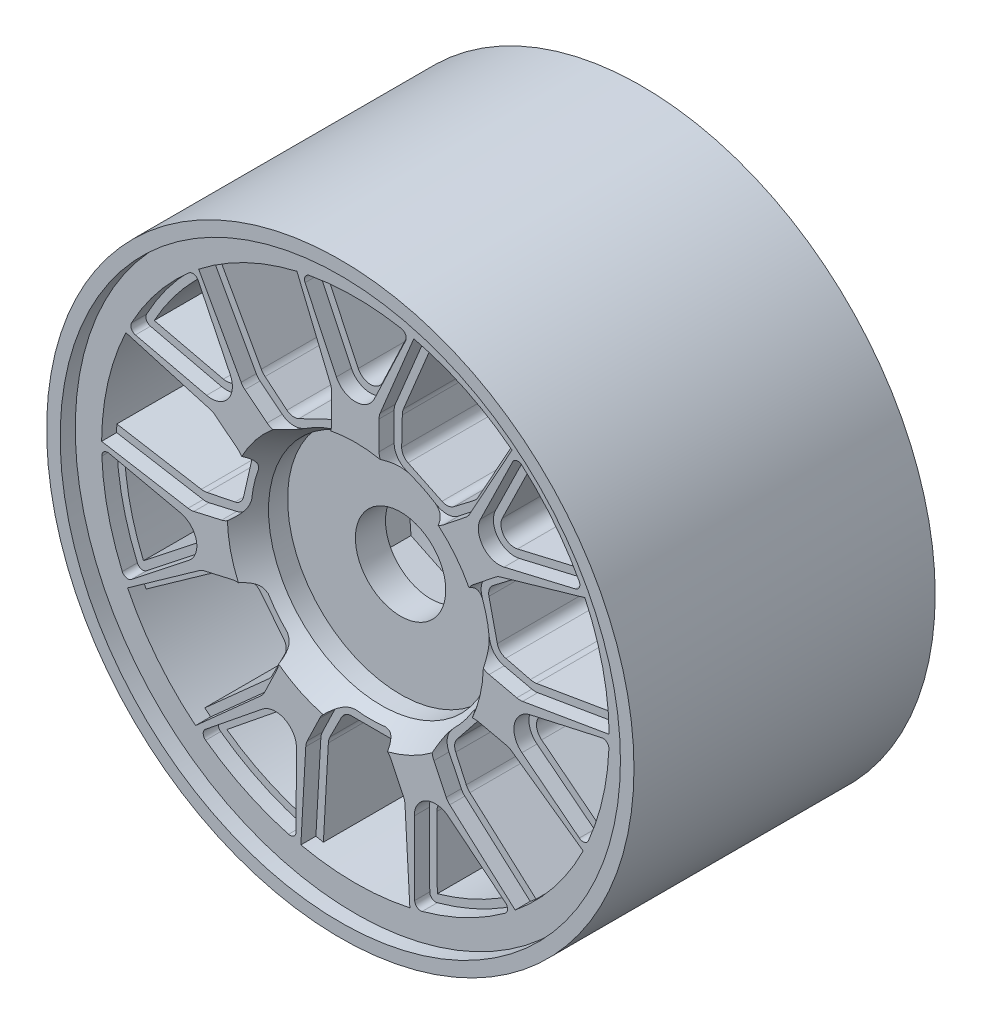
from build123d import *
from build123d.topology import SkipClean

# Parameters (mm, degrees)
SKETCH1_R           = 39
BOSS_EXTRUDE1_DEPTH = 40
SKETCH2_R           = 38
CUT_EXTRUDE1_DEPTH  = 19
SKETCH3_R           = 37.2
CUT_EXTRUDE2_DEPTH  = 2
SKETCH5_R           = 6
CUT_EXTRUDE3_DEPTH  = 67.977608199
CUT_EXTRUDE5_DEPTH  = 2
SKETCH8_R           = 15
CUT_EXTRUDE6_DEPTH  = 6
CUT_EXTRUDE7_DEPTH  = 67.977608199
CUT_EXTRUDE10_DEPTH = 5.5
CUT_EXTRUDE11_START = -5.5
CUT_EXTRUDE11_DEPTH = 5.5
CUT_EXTRUDE12_DEPTH = 3.5
CUT_EXTRUDE14_START = -3.5
SKETCH23_R          = 12.5
CUT_EXTRUDE14_DEPTH = 3.5
CHAMFER1_SIZE       = 2
CHAMFER1_SIZE_2     = 3.464101615
CHAMFER2_SIZE       = 2
CHAMFER2_SIZE2      = 3.464101615


with BuildPart() as part:
    # Sketch1 → Boss-Extrude1 (new body)
    with BuildSketch(Plane.XY):
        Circle(SKETCH1_R)
    extrude(amount=BOSS_EXTRUDE1_DEPTH)

    # Sketch2 → Cut-Extrude1 (cut)
    with BuildSketch(Plane(origin=(0, 0, 0), x_dir=(-1, 0, 0), z_dir=(0, 0, -1))):
        Circle(SKETCH2_R)
    extrude(amount=-CUT_EXTRUDE1_DEPTH, mode=Mode.SUBTRACT)

    # Sketch3 → Cut-Extrude2 (cut)
    with BuildSketch(Plane.XY.offset(40)):
        Circle(SKETCH3_R)
    extrude(amount=-CUT_EXTRUDE2_DEPTH, mode=Mode.SUBTRACT)

    # Sketch5 → Cut-Extrude3 (cut, through all)
    with BuildSketch(Plane.XY.offset(38)):
        Circle(SKETCH5_R)
    extrude(amount=-CUT_EXTRUDE3_DEPTH, mode=Mode.SUBTRACT)

    # Sketch7 → Cut-Extrude5 (cut)
    # profile 1 of 28: a face of its own
    with SkipClean():  # the faces are left unmerged after this step: merging them gives an invalid solid
        with BuildSketch(Plane.XY.offset(38)):
            with BuildLine():
                Line((-6.678926936, 32.03059459), (-2.521652312, 23.260783037))
                ThreePointArc((-2.521652312, 23.260783037), (0, 21.665520789), (2.521652312, 23.260783037))
                Line((2.521652312, 23.260783037), (6.678926936, 32.03059459))
                ThreePointArc((6.678926936, 32.03059459), (6.668415533, 32.725975183), (6.110638146, 33.141365413))
                ThreePointArc((6.110638146, 33.141365413), (0, 33.7), (-6.110638146, 33.141365413))
                ThreePointArc((-6.110638146, 33.141365413), (-6.668415533, 32.725975183), (-6.678926936, 32.03059459))
            make_face()
            with BuildLine():
                ThreePointArc((-1.618040213, 23.689134733), (0, 22.665520789), (1.618040213, 23.689134733))
                Line((1.618040213, 23.689134733), (5.655950279, 32.20714558))
                ThreePointArc((5.655950279, 32.20714558), (0, 32.7), (-5.655950279, 32.20714558))
                Line((-5.655950279, 32.20714558), (-1.618040213, 23.689134733))
            make_face(mode=Mode.SUBTRACT)
        # profile 2 of 28: a face of its own
        with BuildSketch(Plane.XY.offset(38)):
            with BuildLine():
                Line((-5.655950279, 32.20714558), (-1.618040213, 23.689134733))
                ThreePointArc((-1.618040213, 23.689134733), (0, 22.665520789), (1.618040213, 23.689134733))
                Line((1.618040213, 23.689134733), (5.655950279, 32.20714558))
                ThreePointArc((5.655950279, 32.20714558), (0, 32.7), (-5.655950279, 32.20714558))
            make_face()
        # profile 3 of 28: a face of its own
        with BuildSketch(Plane.XY.offset(38)):
            with BuildLine():
                ThreePointArc((-4.565290652, 15.241835898), (-3.533189502, 16.164177877), (-3.15, 17.494258068))
                Line((-3.15, 17.494258068), (-3.15, 21.267696054))
                ThreePointArc((-3.15, 21.267696054), (-3.188429439, 21.657876698), (-3.302240935, 22.033062919))
                Line((-3.302240935, 22.033062919), (-7.759755002, 32.794453835))
                ThreePointArc((-7.759755002, 32.794453835), (-8.250633181, 32.674409744), (-8.739656117, 32.547018465))
                Line((-8.739656117, 32.547018465), (-4.2323922, 21.665520789))
                ThreePointArc((-4.2323922, 21.665520789), (-4.114660372, 21.270080334), (-4.080576857, 20.858896372))
                Line((-4.080576857, 20.858896372), (-4.15, 17.494258068))
                ThreePointArc((-4.15, 17.494258068), (-4.379913701, 16.696209953), (-4.999174391, 16.142804766))
                Line((-4.999174391, 16.142804766), (-9.504018731, 13.973386071))
                ThreePointArc((-9.504018731, 13.973386071), (-10.322791054, 13.834271058), (-11.090079042, 14.152092149))
                Line((-11.090079042, 14.152092149), (-13.98890096, 16.569209067))
                ThreePointArc((-13.98890096, 16.569209067), (-14.269996108, 16.842528065), (-14.4923682, 17.165434258))
                Line((-14.4923682, 17.165434258), (-19.997197236, 27.125672392))
                ThreePointArc((-19.997197236, 27.125672392), (-20.401696562, 26.822766028), (-20.801608349, 26.51382828))
                Line((-20.801608349, 26.51382828), (-15.167228699, 16.319185959))
                ThreePointArc((-15.167228699, 16.319185959), (-14.944856607, 15.996279766), (-14.663761459, 15.722960768))
                Line((-14.663761459, 15.722960768), (-11.713568844, 13.370260666))
                ThreePointArc((-11.713568844, 13.370260666), (-10.43475553, 12.840558848), (-9.070134992, 13.072417203))
                Line((-9.070134992, 13.072417203), (-4.565290652, 15.241835898))
            make_face()
        # profile 4 of 28: a face of its own
        with BuildSketch(Plane.XY.offset(38)):
            with BuildLine():
                ThreePointArc((-19.997197236, 27.125672392), (-14.621882008, 30.362650848), (-8.739656117, 32.547018465))
                Line((-8.739656117, 32.547018465), (-4.2323922, 21.665520789))
                ThreePointArc((-4.2323922, 21.665520789), (-4.114660372, 21.270080334), (-4.080576857, 20.858896372))
                Line((-4.080576857, 20.858896372), (-4.15, 17.494258068))
                ThreePointArc((-4.15, 17.494258068), (-4.379913701, 16.696209953), (-4.999174391, 16.142804766))
                Line((-4.999174391, 16.142804766), (-9.504018731, 13.973386071))
                ThreePointArc((-9.504018731, 13.973386071), (-10.322791054, 13.834271058), (-11.090079042, 14.152092149))
                Line((-11.090079042, 14.152092149), (-13.98890096, 16.569209067))
                ThreePointArc((-13.98890096, 16.569209067), (-14.269996108, 16.842528065), (-14.4923682, 17.165434258))
                Line((-14.4923682, 17.165434258), (-19.997197236, 27.125672392))
            make_face()
        # profile 5 of 28: a face of its own
        with BuildSketch(Plane.XY.offset(38)):
            with BuildLine():
                Line((-29.206770085, 14.748953727), (-19.758236986, 12.531353842))
                ThreePointArc((-19.758236986, 12.531353842), (-16.938786237, 13.508231264), (-16.613787985, 16.474368172))
                Line((-16.613787985, 16.474368172), (-20.878284421, 25.192544422))
                ThreePointArc((-20.878284421, 25.192544422), (-21.428508613, 25.617888985), (-22.101042285, 25.440792635))
                ThreePointArc((-22.101042285, 25.440792635), (-26.347720959, 21.011606323), (-29.720883419, 15.885814074))
                ThreePointArc((-29.720883419, 15.885814074), (-29.743886772, 15.19073458), (-29.206770085, 14.748953727))
            make_face()
            with BuildLine():
                ThreePointArc((-19.529742898, 13.504899142), (-17.720617719, 14.131721065), (-17.512079755, 16.034968699))
                Line((-17.512079755, 16.034968699), (-21.654133056, 24.502826808))
                ThreePointArc((-21.654133056, 24.502826808), (-25.565889477, 20.388116521), (-28.706987694, 15.658826825))
                Line((-28.706987694, 15.658826825), (-19.529742898, 13.504899142))
            make_face(mode=Mode.SUBTRACT)
        # profile 6 of 28: a face of its own
        with BuildSketch(Plane.XY.offset(38)):
            with BuildLine():
                Line((-28.706987694, 15.658826825), (-19.529742898, 13.504899142))
                ThreePointArc((-19.529742898, 13.504899142), (-17.720617719, 14.131721065), (-17.512079755, 16.034968699))
                Line((-17.512079755, 16.034968699), (-21.654133056, 24.502826808))
                ThreePointArc((-21.654133056, 24.502826808), (-25.565889477, 20.388116521), (-28.706987694, 15.658826825))
            make_face()
        # profile 7 of 28: a face of its own
        with BuildSketch(Plane.XY.offset(38)):
            with BuildLine():
                ThreePointArc((-14.76295932, 5.933841286), (-14.840570775, 7.315841275), (-15.641554596, 8.444722327))
                Line((-15.641554596, 8.444722327), (-18.59174721, 10.797422429))
                ThreePointArc((-18.59174721, 10.797422429), (-18.920763085, 11.010650736), (-19.285055791, 11.155594108))
                Line((-19.285055791, 11.155594108), (-30.477864567, 14.380186766))
                ThreePointArc((-30.477864567, 14.380186766), (-30.690067856, 13.921556486), (-30.895370157, 13.459795796))
                Line((-30.895370157, 13.459795796), (-19.577639611, 10.199213795))
                ThreePointArc((-19.577639611, 10.199213795), (-19.19506722, 10.044707154), (-18.852339929, 9.814985712))
                Line((-18.852339929, 9.814985712), (-16.265044398, 7.662890844))
                ThreePointArc((-16.265044398, 7.662890844), (-15.784454105, 6.985562213), (-15.737887232, 6.15636222))
                Line((-15.737887232, 6.15636222), (-16.850491902, 1.281722659))
                ThreePointArc((-16.850491902, 1.281722659), (-17.252223599, 0.554843888), (-17.979102369, 0.153112191))
                Line((-17.979102369, 0.153112191), (-21.676266376, -0.606230298))
                ThreePointArc((-21.676266376, -0.606230298), (-22.065215731, -0.655587726), (-22.45632069, -0.62811651))
                Line((-22.45632069, -0.62811651), (-33.675753201, 1.278141745))
                ThreePointArc((-33.675753201, 1.278141745), (-33.691132675, 0.773032409), (-33.698936338, 0.267749248))
                Line((-33.698936338, 0.267749248), (-22.215465767, -1.683370878))
                ThreePointArc((-22.215465767, -1.683370878), (-21.824360808, -1.710842094), (-21.435411453, -1.661484666))
                Line((-21.435411453, -1.661484666), (-17.756581435, -0.821815721))
                ThreePointArc((-17.756581435, -0.821815721), (-16.545116817, -0.152262893), (-15.87556399, 1.059201725))
                Line((-15.87556399, 1.059201725), (-14.76295932, 5.933841286))
            make_face()
        # profile 8 of 28: a face of its own
        with BuildSketch(Plane.XY.offset(38)):
            with BuildLine():
                ThreePointArc((-33.675753201, 1.278141745), (-32.855070641, 7.498955474), (-30.895370157, 13.459795796))
                Line((-30.895370157, 13.459795796), (-19.577639611, 10.199213795))
                ThreePointArc((-19.577639611, 10.199213795), (-19.19506722, 10.044707154), (-18.852339929, 9.814985712))
                Line((-18.852339929, 9.814985712), (-16.265044398, 7.662890844))
                ThreePointArc((-16.265044398, 7.662890844), (-15.784454105, 6.985562213), (-15.737887232, 6.15636222))
                Line((-15.737887232, 6.15636222), (-16.850491902, 1.281722659))
                ThreePointArc((-16.850491902, 1.281722659), (-17.252223599, 0.554843888), (-17.979102369, 0.153112191))
                Line((-17.979102369, 0.153112191), (-21.676266376, -0.606230298))
                ThreePointArc((-21.676266376, -0.606230298), (-22.065215731, -0.655587726), (-22.45632069, -0.62811651))
                Line((-22.45632069, -0.62811651), (-33.675753201, 1.278141745))
            make_face()
        # profile 9 of 28: a face of its own
        with BuildSketch(Plane.XY.offset(38)):
            with BuildLine():
                ThreePointArc((-32.71372177, -0.61600553), (-33.389328712, -0.780990129), (-33.670187096, -1.417215895))
                ThreePointArc((-33.670187096, -1.417215895), (-32.855070641, -7.498955474), (-30.950697282, -13.332079274))
                ThreePointArc((-30.950697282, -13.332079274), (-30.421604607, -13.783438996), (-29.74131965, -13.638950117))
                Line((-29.74131965, -13.638950117), (-22.116466215, -7.63444039))
                ThreePointArc((-22.116466215, -7.63444039), (-21.211792928, -6.37176583), (-21.122320942, -4.821031951))
                ThreePointArc((-21.122320942, -4.821031951), (-21.875770622, -3.462689405), (-23.23870707, -2.717581942))
                Line((-23.23870707, -2.717581942), (-32.71372177, -0.61600553))
            make_face()
            with BuildLine():
                Line((-22.735150847, -6.848800952), (-30.14107786, -12.680907912))
                ThreePointArc((-30.14107786, -12.680907912), (-31.880142728, -7.27643454), (-32.658212537, -1.652620318))
                Line((-32.658212537, -1.652620318), (-23.455246486, -3.693855819))
                ThreePointArc((-23.455246486, -3.693855819), (-22.097248861, -5.043552854), (-22.735150847, -6.848800952))
            make_face(mode=Mode.SUBTRACT)
        # profile 10 of 28: a face of its own
        with BuildSketch(Plane.XY.offset(38)):
            with BuildLine():
                Line((-30.14107786, -12.680907912), (-22.735150847, -6.848800952))
                ThreePointArc((-22.735150847, -6.848800952), (-22.097248861, -5.043552854), (-23.455246486, -3.693855819))
                Line((-23.455246486, -3.693855819), (-32.658212537, -1.652620318))
                ThreePointArc((-32.658212537, -1.652620318), (-31.880142728, -7.27643454), (-30.14107786, -12.680907912))
            make_face()
        # profile 11 of 28: a face of its own
        with BuildSketch(Plane.XY.offset(38)):
            with BuildLine():
                ThreePointArc((-13.84381851, -7.842456843), (-14.972699562, -7.041473022), (-16.354699551, -6.963861568))
                Line((-16.354699551, -6.963861568), (-20.033529569, -7.803530512))
                ThreePointArc((-20.033529569, -7.803530512), (-20.405376215, -7.927819807), (-20.745830293, -8.122264599))
                Line((-20.745830293, -8.122264599), (-30.245520478, -14.862654239))
                ThreePointArc((-30.245520478, -14.862654239), (-30.019255472, -15.314512754), (-29.786240318, -15.762927637))
                Line((-29.786240318, -15.762927637), (-20.180525083, -8.947309212))
                ThreePointArc((-20.180525083, -8.947309212), (-19.821196943, -8.744535387), (-19.427906517, -8.619809378))
                Line((-19.427906517, -8.619809378), (-16.132178618, -7.93878948))
                ThreePointArc((-16.132178618, -7.93878948), (-15.302978624, -7.985356353), (-14.625649993, -8.465946645))
                Line((-14.625649993, -8.465946645), (-11.508200984, -12.375104058))
                ThreePointArc((-11.508200984, -12.375104058), (-11.190379892, -13.142392046), (-11.329494905, -13.961164369))
                Line((-11.329494905, -13.961164369), (-13.040961095, -17.325165883))
                ThreePointArc((-13.040961095, -17.325165883), (-13.244877861, -17.660032588), (-13.510205675, -17.948682735))
                Line((-13.510205675, -17.948682735), (-21.995780146, -25.531855705))
                ThreePointArc((-21.995780146, -25.531855705), (-21.61045871, -25.858810382), (-21.220277932, -26.17995043))
                Line((-21.220277932, -26.17995043), (-12.535004, -18.41831511))
                ThreePointArc((-12.535004, -18.41831511), (-12.269676185, -18.129664963), (-12.06575942, -17.794798258))
                Line((-12.06575942, -17.794798258), (-10.428526038, -14.395048108))
                ThreePointArc((-10.428526038, -14.395048108), (-10.196667683, -13.03042757), (-10.726369501, -11.751614256))
                Line((-10.726369501, -11.751614256), (-13.84381851, -7.842456843))
            make_face()
        # profile 12 of 28: a face of its own
        with BuildSketch(Plane.XY.offset(38)):
            with BuildLine():
                Line((-20.180525083, -8.947309212), (-29.786240318, -15.762927637))
                ThreePointArc((-29.786240318, -15.762927637), (-26.347720959, -21.011606323), (-21.995780146, -25.531855705))
                Line((-21.995780146, -25.531855705), (-13.510205675, -17.948682735))
                ThreePointArc((-13.510205675, -17.948682735), (-13.244877861, -17.660032588), (-13.040961095, -17.325165883))
                Line((-13.040961095, -17.325165883), (-11.329494905, -13.961164369))
                ThreePointArc((-11.329494905, -13.961164369), (-11.190379892, -13.142392046), (-11.508200984, -12.375104058))
                Line((-11.508200984, -12.375104058), (-14.625649993, -8.465946645))
                ThreePointArc((-14.625649993, -8.465946645), (-15.302978624, -7.985356353), (-16.132178618, -7.93878948))
                Line((-16.132178618, -7.93878948), (-19.427906517, -8.619809378))
                ThreePointArc((-19.427906517, -8.619809378), (-19.821196943, -8.744535387), (-20.180525083, -8.947309212))
            make_face()
        # profile 13 of 28: a face of its own
        with BuildSketch(Plane.XY.offset(38)):
            with BuildLine():
                ThreePointArc((-19.915059388, -25.960690754), (-20.207303272, -26.591767746), (-19.884994277, -27.20803195))
                ThreePointArc((-19.884994277, -27.20803195), (-14.621882008, -30.362650848), (-8.874004813, -32.510645004))
                ThreePointArc((-8.874004813, -32.510645004), (-8.191233685, -32.378401877), (-7.880048907, -31.756446339))
                Line((-7.880048907, -31.756446339), (-7.82054529, -22.051345293))
                ThreePointArc((-7.82054529, -22.051345293), (-8.243689458, -20.556778504), (-9.400317186, -19.519959729))
                ThreePointArc((-9.400317186, -19.519959729), (-10.932080324, -19.262117709), (-12.364405748, -19.863137426))
                Line((-12.364405748, -19.863137426), (-19.915059388, -25.960690754))
            make_face()
            with BuildLine():
                Line((-8.820526495, -22.045214239), (-8.878321631, -31.471660347))
                ThreePointArc((-8.878321631, -31.471660347), (-14.187998269, -29.46168198), (-19.069991871, -26.563610637))
                Line((-19.069991871, -26.563610637), (-11.736134213, -20.641131564))
                ThreePointArc((-11.736134213, -20.641131564), (-9.834200909, -20.420928605), (-8.820526495, -22.045214239))
            make_face(mode=Mode.SUBTRACT)
        # profile 14 of 28: a face of its own
        with BuildSketch(Plane.XY.offset(38)):
            with BuildLine():
                Line((-8.878321631, -31.471660347), (-8.820526495, -22.045214239))
                ThreePointArc((-8.820526495, -22.045214239), (-9.834200909, -20.420928605), (-11.736134213, -20.641131564))
                Line((-11.736134213, -20.641131564), (-19.069991871, -26.563610637))
                ThreePointArc((-19.069991871, -26.563610637), (-14.187998269, -29.46168198), (-8.878321631, -31.471660347))
            make_face()
        # profile 15 of 28: a face of its own
        with BuildSketch(Plane.XY.offset(38)):
            with BuildLine():
                ThreePointArc((-2.5, -15.713225012), (-3.830080191, -16.096414514), (-4.75242217, -17.128515665))
                Line((-4.75242217, -17.128515665), (-6.389655552, -20.528265815))
                ThreePointArc((-6.389655552, -20.528265815), (-6.524324861, -20.896480337), (-6.584571447, -21.283892398))
                Line((-6.584571447, -21.283892398), (-7.237682572, -32.91361346))
                ThreePointArc((-7.237682572, -32.91361346), (-6.743331437, -33.018441531), (-6.247463991, -33.115845055))
                Line((-6.247463991, -33.115845055), (-5.58706356, -21.356325891))
                ThreePointArc((-5.58706356, -21.356325891), (-5.521561089, -20.948964426), (-5.37386324, -20.563712194))
                Line((-5.37386324, -20.563712194), (-3.851453302, -17.562399404))
                ThreePointArc((-3.851453302, -17.562399404), (-3.298048115, -16.943138714), (-2.5, -16.713225012))
                Line((-2.5, -16.713225012), (2.5, -16.713225012))
                ThreePointArc((2.5, -16.713225012), (3.298048115, -16.943138714), (3.851453302, -17.562399404))
                Line((3.851453302, -17.562399404), (5.414453877, -20.99789819))
                ThreePointArc((5.414453877, -20.99789819), (5.549123185, -21.366112712), (5.609369771, -21.753524774))
                Line((5.609369771, -21.753524774), (6.247463991, -33.115845055))
                ThreePointArc((6.247463991, -33.115845055), (6.743331437, -33.018441531), (7.237682572, -32.91361346))
                Line((7.237682572, -32.91361346), (6.584571447, -21.283892398))
                ThreePointArc((6.584571447, -21.283892398), (6.524324861, -20.896480337), (6.389655552, -20.528265815))
                Line((6.389655552, -20.528265815), (4.75242217, -17.128515665))
                ThreePointArc((4.75242217, -17.128515665), (3.830080191, -16.096414514), (2.5, -15.713225012))
                Line((2.5, -15.713225012), (-2.5, -15.713225012))
            make_face()
        # profile 16 of 28: a face of its own
        with BuildSketch(Plane.XY.offset(38)):
            with BuildLine():
                Line((-5.58706356, -21.356325891), (-6.247463991, -33.115845055))
                ThreePointArc((-6.247463991, -33.115845055), (0, -33.7), (6.247463991, -33.115845055))
                Line((6.247463991, -33.115845055), (5.609369771, -21.753524774))
                ThreePointArc((5.609369771, -21.753524774), (5.549123185, -21.366112712), (5.414453877, -20.99789819))
                Line((5.414453877, -20.99789819), (3.851453302, -17.562399404))
                ThreePointArc((3.851453302, -17.562399404), (3.298048115, -16.943138714), (2.5, -16.713225012))
                Line((2.5, -16.713225012), (-2.5, -16.713225012))
                ThreePointArc((-2.5, -16.713225012), (-3.298048115, -16.943138714), (-3.851453302, -17.562399404))
                Line((-3.851453302, -17.562399404), (-5.37386324, -20.563712194))
                ThreePointArc((-5.37386324, -20.563712194), (-5.521561089, -20.948964426), (-5.58706356, -21.356325891))
            make_face()
        # profile 17 of 28: a face of its own
        with BuildSketch(Plane.XY.offset(38)):
            with BuildLine():
                ThreePointArc((8.874004813, -32.510645004), (14.621882008, -30.362650848), (19.884994277, -27.20803195))
                ThreePointArc((19.884994277, -27.20803195), (20.207303272, -26.591767746), (19.915059388, -25.960690754))
                Line((19.915059388, -25.960690754), (12.364405748, -19.863137426))
                ThreePointArc((12.364405748, -19.863137426), (10.932080264, -19.262117702), (9.400317077, -19.519959782))
                ThreePointArc((9.400317077, -19.519959782), (8.243689426, -20.556778556), (7.82054529, -22.051345293))
                Line((7.82054529, -22.051345293), (7.880048907, -31.756446339))
                ThreePointArc((7.880048907, -31.756446339), (8.191233685, -32.378401877), (8.874004813, -32.510645004))
            make_face()
            with BuildLine():
                Line((11.736134213, -20.641131564), (19.069991871, -26.563610637))
                ThreePointArc((19.069991871, -26.563610637), (14.187998269, -29.46168198), (8.878321631, -31.471660347))
                Line((8.878321631, -31.471660347), (8.820526495, -22.045214239))
                ThreePointArc((8.820526495, -22.045214239), (9.834200909, -20.420928605), (11.736134213, -20.641131564))
            make_face(mode=Mode.SUBTRACT)
        # profile 18 of 28: a face of its own
        with BuildSketch(Plane.XY.offset(38)):
            with BuildLine():
                Line((19.069991871, -26.563610637), (11.736134213, -20.641131564))
                ThreePointArc((11.736134213, -20.641131564), (9.834200909, -20.420928605), (8.820526495, -22.045214239))
                Line((8.820526495, -22.045214239), (8.878321631, -31.471660347))
                ThreePointArc((8.878321631, -31.471660347), (14.187998269, -29.46168198), (19.069991871, -26.563610637))
            make_face()
        # profile 19 of 28: a face of its own
        with BuildSketch(Plane.XY.offset(38)):
            with BuildLine():
                Line((20.033529569, -7.803530512), (16.354699551, -6.963861568))
                ThreePointArc((16.354699551, -6.963861568), (14.972699562, -7.041473022), (13.84381851, -7.842456843))
                Line((13.84381851, -7.842456843), (10.726369501, -11.751614256))
                ThreePointArc((10.726369501, -11.751614256), (10.196667683, -13.03042757), (10.428526038, -14.395048108))
                Line((10.428526038, -14.395048108), (12.06575942, -17.794798258))
                ThreePointArc((12.06575942, -17.794798258), (12.269676185, -18.129664963), (12.535004, -18.41831511))
                Line((12.535004, -18.41831511), (21.220277932, -26.17995043))
                ThreePointArc((21.220277932, -26.17995043), (21.61045871, -25.858810382), (21.995780146, -25.531855705))
                Line((21.995780146, -25.531855705), (13.213570779, -17.683593584))
                ThreePointArc((13.213570779, -17.683593584), (12.935922884, -17.378395971), (12.726808663, -17.022720305))
                Line((12.726808663, -17.022720305), (11.329494905, -13.961164369))
                ThreePointArc((11.329494905, -13.961164369), (11.190379892, -13.142392046), (11.508200984, -12.375104058))
                Line((11.508200984, -12.375104058), (14.625649993, -8.465946645))
                ThreePointArc((14.625649993, -8.465946645), (15.302978624, -7.985356353), (16.132178618, -7.93878948))
                Line((16.132178618, -7.93878948), (19.792674645, -8.85878488))
                ThreePointArc((19.792674645, -8.85878488), (20.164521291, -8.983074175), (20.50497537, -9.177518967))
                Line((20.50497537, -9.177518967), (29.786240318, -15.762927637))
                ThreePointArc((29.786240318, -15.762927637), (30.019255472, -15.314512754), (30.245520478, -14.862654239))
                Line((30.245520478, -14.862654239), (20.745830293, -8.122264599))
                ThreePointArc((20.745830293, -8.122264599), (20.405376215, -7.927819807), (20.033529569, -7.803530512))
            make_face()
        # profile 20 of 28: a face of its own
        with BuildSketch(Plane.XY.offset(38)):
            with BuildLine():
                ThreePointArc((21.995780146, -25.531855705), (26.347720959, -21.011606323), (29.786240318, -15.762927637))
                Line((29.786240318, -15.762927637), (20.50497537, -9.177518967))
                ThreePointArc((20.50497537, -9.177518967), (20.164521291, -8.983074175), (19.792674645, -8.85878488))
                Line((19.792674645, -8.85878488), (16.132178618, -7.93878948))
                ThreePointArc((16.132178618, -7.93878948), (15.302978624, -7.985356353), (14.625649993, -8.465946645))
                Line((14.625649993, -8.465946645), (11.508200984, -12.375104058))
                ThreePointArc((11.508200984, -12.375104058), (11.190379892, -13.142392046), (11.329494905, -13.961164369))
                Line((11.329494905, -13.961164369), (12.726808663, -17.022720305))
                ThreePointArc((12.726808663, -17.022720305), (12.935922884, -17.378395971), (13.213570779, -17.683593584))
                Line((13.213570779, -17.683593584), (21.995780146, -25.531855705))
            make_face()
        # profile 21 of 28: a face of its own
        with BuildSketch(Plane.XY.offset(38)):
            with BuildLine():
                ThreePointArc((30.950697282, -13.332079274), (32.855070641, -7.498955474), (33.670187096, -1.417215895))
                ThreePointArc((33.670187096, -1.417215895), (33.389328712, -0.780990129), (32.71372177, -0.61600553))
                Line((32.71372177, -0.61600553), (23.23870707, -2.717581942))
                ThreePointArc((23.23870707, -2.717581942), (21.875770612, -3.462689415), (21.122320936, -4.821031978))
                ThreePointArc((21.122320936, -4.821031978), (21.211792933, -6.371765843), (22.116466215, -7.63444039))
                Line((22.116466215, -7.63444039), (29.74131965, -13.638950117))
                ThreePointArc((29.74131965, -13.638950117), (30.421604607, -13.783438996), (30.950697282, -13.332079274))
            make_face()
            with BuildLine():
                Line((23.455246486, -3.693855819), (32.658212537, -1.652620318))
                ThreePointArc((32.658212537, -1.652620318), (31.880142728, -7.27643454), (30.14107786, -12.680907912))
                Line((30.14107786, -12.680907912), (22.735150847, -6.848800952))
                ThreePointArc((22.735150847, -6.848800952), (22.097248861, -5.043552854), (23.455246486, -3.693855819))
            make_face(mode=Mode.SUBTRACT)
        # profile 22 of 28: a face of its own
        with BuildSketch(Plane.XY.offset(38)):
            with BuildLine():
                Line((32.658212537, -1.652620318), (23.455246486, -3.693855819))
                ThreePointArc((23.455246486, -3.693855819), (22.097248861, -5.043552854), (22.735150847, -6.848800952))
                Line((22.735150847, -6.848800952), (30.14107786, -12.680907912))
                ThreePointArc((30.14107786, -12.680907912), (31.880142728, -7.27643454), (32.658212537, -1.652620318))
            make_face()
        # profile 23 of 28: a face of its own
        with BuildSketch(Plane.XY.offset(38)):
            with BuildLine():
                Line((18.59174721, 10.797422429), (15.641554596, 8.444722327))
                ThreePointArc((15.641554596, 8.444722327), (14.840570775, 7.315841275), (14.76295932, 5.933841286))
                Line((14.76295932, 5.933841286), (15.87556399, 1.059201725))
                ThreePointArc((15.87556399, 1.059201725), (16.545116817, -0.152262893), (17.756581435, -0.821815721))
                Line((17.756581435, -0.821815721), (21.435411453, -1.661484666))
                ThreePointArc((21.435411453, -1.661484666), (21.824360808, -1.710842094), (22.215465767, -1.683370878))
                Line((22.215465767, -1.683370878), (33.698936338, 0.267749248))
                ThreePointArc((33.698936338, 0.267749248), (33.691132675, 0.773032409), (33.675753201, 1.278141745))
                Line((33.675753201, 1.278141745), (22.064116814, -0.694754629))
                ThreePointArc((22.064116814, -0.694754629), (21.652393081, -0.721540895), (21.243934063, -0.663272826))
                Line((21.243934063, -0.663272826), (17.979102369, 0.153112191))
                ThreePointArc((17.979102369, 0.153112191), (17.252223599, 0.554843888), (16.850491902, 1.281722659))
                Line((16.850491902, 1.281722659), (15.737887232, 6.15636222))
                ThreePointArc((15.737887232, 6.15636222), (15.784454105, 6.985562213), (16.265044398, 7.662890844))
                Line((16.265044398, 7.662890844), (19.266607709, 9.95117413))
                ThreePointArc((19.266607709, 9.95117413), (19.595623584, 10.164402437), (19.95991629, 10.309345809))
                Line((19.95991629, 10.309345809), (30.895370157, 13.459795796))
                ThreePointArc((30.895370157, 13.459795796), (30.690067856, 13.921556486), (30.477864567, 14.380186766))
                Line((30.477864567, 14.380186766), (19.285055791, 11.155594108))
                ThreePointArc((19.285055791, 11.155594108), (18.920763085, 11.010650736), (18.59174721, 10.797422429))
            make_face()
        # profile 24 of 28: a face of its own
        with BuildSketch(Plane.XY.offset(38)):
            with BuildLine():
                ThreePointArc((30.895370157, 13.459795796), (32.855070641, 7.498955474), (33.675753201, 1.278141745))
                Line((33.675753201, 1.278141745), (22.064116814, -0.694754629))
                ThreePointArc((22.064116814, -0.694754629), (21.652393081, -0.721540895), (21.243934063, -0.663272826))
                Line((21.243934063, -0.663272826), (17.979102369, 0.153112191))
                ThreePointArc((17.979102369, 0.153112191), (17.252223599, 0.554843888), (16.850491902, 1.281722659))
                Line((16.850491902, 1.281722659), (15.737887232, 6.15636222))
                ThreePointArc((15.737887232, 6.15636222), (15.784454105, 6.985562213), (16.265044398, 7.662890844))
                Line((16.265044398, 7.662890844), (19.266607709, 9.95117413))
                ThreePointArc((19.266607709, 9.95117413), (19.595623584, 10.164402437), (19.95991629, 10.309345809))
                Line((19.95991629, 10.309345809), (30.895370157, 13.459795796))
            make_face()
        # profile 25 of 28: a face of its own
        with BuildSketch(Plane.XY.offset(38)):
            with BuildLine():
                ThreePointArc((8.739656117, 32.547018465), (14.621882008, 30.362650848), (19.997197236, 27.125672392))
                Line((19.997197236, 27.125672392), (14.299932862, 16.817248732))
                ThreePointArc((14.299932862, 16.817248732), (14.064169659, 16.478649191), (13.763943817, 16.195632619))
                Line((13.763943817, 16.195632619), (11.090079042, 14.152092149))
                ThreePointArc((11.090079042, 14.152092149), (10.322791054, 13.834271058), (9.504018731, 13.973386071))
                Line((9.504018731, 13.973386071), (4.999174391, 16.142804766))
                ThreePointArc((4.999174391, 16.142804766), (4.379913701, 16.696209953), (4.15, 17.494258068))
                Line((4.15, 17.494258068), (4.2323922, 21.267696054))
                ThreePointArc((4.2323922, 21.267696054), (4.270821639, 21.657876698), (4.384633135, 22.033062919))
                Line((4.384633135, 22.033062919), (8.739656117, 32.547018465))
            make_face()
        # profile 26 of 28: a face of its own
        with BuildSketch(Plane.XY.offset(38)):
            with BuildLine():
                Line((3.15, 21.267696054), (3.15, 17.494258068))
                ThreePointArc((3.15, 17.494258068), (3.533189502, 16.164177877), (4.565290652, 15.241835898))
                Line((4.565290652, 15.241835898), (9.070134992, 13.072417203))
                ThreePointArc((9.070134992, 13.072417203), (10.43475553, 12.840558848), (11.713568844, 13.370260666))
                Line((11.713568844, 13.370260666), (14.663761459, 15.722960768))
                ThreePointArc((14.663761459, 15.722960768), (14.944856607, 15.996279766), (15.167228699, 16.319185959))
                Line((15.167228699, 16.319185959), (20.801608349, 26.51382828))
                ThreePointArc((20.801608349, 26.51382828), (20.401696562, 26.822766028), (19.997197236, 27.125672392))
                Line((19.997197236, 27.125672392), (14.299932862, 16.817248732))
                ThreePointArc((14.299932862, 16.817248732), (14.064169659, 16.478649191), (13.763943817, 16.195632619))
                Line((13.763943817, 16.195632619), (11.090079042, 14.152092149))
                ThreePointArc((11.090079042, 14.152092149), (10.322791054, 13.834271058), (9.504018731, 13.973386071))
                Line((9.504018731, 13.973386071), (4.999174391, 16.142804766))
                ThreePointArc((4.999174391, 16.142804766), (4.379913701, 16.696209953), (4.15, 17.494258068))
                Line((4.15, 17.494258068), (4.2323922, 21.267696054))
                ThreePointArc((4.2323922, 21.267696054), (4.270821639, 21.657876698), (4.384633135, 22.033062919))
                Line((4.384633135, 22.033062919), (8.739656117, 32.547018465))
                ThreePointArc((8.739656117, 32.547018465), (8.250633181, 32.674409744), (7.759755002, 32.794453835))
                Line((7.759755002, 32.794453835), (3.302240935, 22.033062919))
                ThreePointArc((3.302240935, 22.033062919), (3.188429439, 21.657876698), (3.15, 21.267696054))
            make_face()
        # profile 27 of 28: a face of its own
        with BuildSketch(Plane.XY.offset(38)):
            with BuildLine():
                Line((20.878284421, 25.192544422), (16.613787985, 16.474368172))
                ThreePointArc((16.613787985, 16.474368172), (16.938786237, 13.508231264), (19.758236986, 12.531353842))
                Line((19.758236986, 12.531353842), (29.206770085, 14.748953727))
                ThreePointArc((29.206770085, 14.748953727), (29.743886772, 15.19073458), (29.720883419, 15.885814074))
                ThreePointArc((29.720883419, 15.885814074), (26.347720959, 21.011606323), (22.101042285, 25.440792635))
                ThreePointArc((22.101042285, 25.440792635), (21.428508613, 25.617888985), (20.878284421, 25.192544422))
            make_face()
            with BuildLine():
                ThreePointArc((17.512079755, 16.034968699), (17.720617719, 14.131721065), (19.529742898, 13.504899142))
                Line((19.529742898, 13.504899142), (28.706987694, 15.658826825))
                ThreePointArc((28.706987694, 15.658826825), (25.565889477, 20.388116521), (21.654133056, 24.502826808))
                Line((21.654133056, 24.502826808), (17.512079755, 16.034968699))
            make_face(mode=Mode.SUBTRACT)
        # profile 28 of 28: a face of its own
        with BuildSketch(Plane.XY.offset(38)):
            with BuildLine():
                Line((21.654133056, 24.502826808), (17.512079755, 16.034968699))
                ThreePointArc((17.512079755, 16.034968699), (17.720617719, 14.131721065), (19.529742898, 13.504899142))
                Line((19.529742898, 13.504899142), (28.706987694, 15.658826825))
                ThreePointArc((28.706987694, 15.658826825), (25.565889477, 20.388116521), (21.654133056, 24.502826808))
            make_face()
        extrude(amount=-CUT_EXTRUDE5_DEPTH, mode=Mode.SUBTRACT)

    # Sketch8 → Cut-Extrude6 (cut)
    with SkipClean():  # the faces are left unmerged after this step: merging them gives an invalid solid
        with BuildSketch(Plane.XY.offset(38)):
            Circle(SKETCH8_R)
        extrude(amount=-CUT_EXTRUDE6_DEPTH, mode=Mode.SUBTRACT)

    # Sketch9 → Cut-Extrude7 (cut, through all)
    with SkipClean():  # the faces are left unmerged after this step: merging them gives an invalid solid
        with BuildSketch(Plane.XY.offset(38)):
            with BuildLine():
                ThreePointArc((-8.739656117, 32.547018465), (-14.621882008, 30.362650848), (-19.997197236, 27.125672392))
                Line((-19.997197236, 27.125672392), (-14.4923682, 17.165434258))
                ThreePointArc((-14.4923682, 17.165434258), (-14.269996108, 16.842528065), (-13.98890096, 16.569209067))
                Line((-13.98890096, 16.569209067), (-11.090079042, 14.152092149))
                ThreePointArc((-11.090079042, 14.152092149), (-10.322791054, 13.834271058), (-9.504018731, 13.973386071))
                Line((-9.504018731, 13.973386071), (-4.999174391, 16.142804766))
                ThreePointArc((-4.999174391, 16.142804766), (-4.379913701, 16.696209953), (-4.15, 17.494258068))
                Line((-4.15, 17.494258068), (-4.080576857, 20.858896372))
                ThreePointArc((-4.080576857, 20.858896372), (-4.114660372, 21.270080334), (-4.2323922, 21.665520789))
                Line((-4.2323922, 21.665520789), (-8.739656117, 32.547018465))
            make_face()
            with BuildLine():
                Line((-17.512079755, 16.034968699), (-21.654133056, 24.502826808))
                ThreePointArc((-21.654133056, 24.502826808), (-25.565889477, 20.388116521), (-28.706987694, 15.658826825))
                Line((-28.706987694, 15.658826825), (-19.529742898, 13.504899142))
                ThreePointArc((-19.529742898, 13.504899142), (-17.720617719, 14.131721065), (-17.512079755, 16.034968699))
            make_face()
            with BuildLine():
                Line((1.618040213, 23.689134733), (5.655950279, 32.20714558))
                ThreePointArc((5.655950279, 32.20714558), (0, 32.7), (-5.655950279, 32.20714558))
                Line((-5.655950279, 32.20714558), (-1.618040213, 23.689134733))
                ThreePointArc((-1.618040213, 23.689134733), (0, 22.665520789), (1.618040213, 23.689134733))
            make_face()
            with BuildLine():
                ThreePointArc((-30.895370157, 13.459795796), (-32.855070641, 7.498955474), (-33.675753201, 1.278141745))
                Line((-33.675753201, 1.278141745), (-22.45632069, -0.62811651))
                ThreePointArc((-22.45632069, -0.62811651), (-22.065215731, -0.655587726), (-21.676266376, -0.606230298))
                Line((-21.676266376, -0.606230298), (-17.979102369, 0.153112191))
                ThreePointArc((-17.979102369, 0.153112191), (-17.252223599, 0.554843888), (-16.850491902, 1.281722659))
                Line((-16.850491902, 1.281722659), (-15.737887232, 6.15636222))
                ThreePointArc((-15.737887232, 6.15636222), (-15.784454105, 6.985562213), (-16.265044398, 7.662890844))
                Line((-16.265044398, 7.662890844), (-18.852339929, 9.814985712))
                ThreePointArc((-18.852339929, 9.814985712), (-19.19506722, 10.044707154), (-19.577639611, 10.199213795))
                Line((-19.577639611, 10.199213795), (-30.895370157, 13.459795796))
            make_face()
            with BuildLine():
                ThreePointArc((19.997197236, 27.125672392), (14.621882008, 30.362650848), (8.739656117, 32.547018465))
                Line((8.739656117, 32.547018465), (4.384633135, 22.033062919))
                ThreePointArc((4.384633135, 22.033062919), (4.270821639, 21.657876698), (4.2323922, 21.267696054))
                Line((4.2323922, 21.267696054), (4.15, 17.494258068))
                ThreePointArc((4.15, 17.494258068), (4.379913701, 16.696209953), (4.999174391, 16.142804766))
                Line((4.999174391, 16.142804766), (9.504018731, 13.973386071))
                ThreePointArc((9.504018731, 13.973386071), (10.322791054, 13.834271058), (11.090079042, 14.152092149))
                Line((11.090079042, 14.152092149), (13.763943817, 16.195632619))
                ThreePointArc((13.763943817, 16.195632619), (14.064169659, 16.478649191), (14.299932862, 16.817248732))
                Line((14.299932862, 16.817248732), (19.997197236, 27.125672392))
            make_face()
            with BuildLine():
                Line((21.654133056, 24.502826808), (17.512079755, 16.034968699))
                ThreePointArc((17.512079755, 16.034968699), (17.720617719, 14.131721065), (19.529742898, 13.504899142))
                Line((19.529742898, 13.504899142), (28.706987694, 15.658826825))
                ThreePointArc((28.706987694, 15.658826825), (25.565889477, 20.388116521), (21.654133056, 24.502826808))
            make_face()
            with BuildLine():
                ThreePointArc((33.675753201, 1.278141745), (32.855070641, 7.498955474), (30.895370157, 13.459795796))
                Line((30.895370157, 13.459795796), (19.95991629, 10.309345809))
                ThreePointArc((19.95991629, 10.309345809), (19.595623584, 10.164402437), (19.266607709, 9.95117413))
                Line((19.266607709, 9.95117413), (16.265044398, 7.662890844))
                ThreePointArc((16.265044398, 7.662890844), (15.784454105, 6.985562213), (15.737887232, 6.15636222))
                Line((15.737887232, 6.15636222), (16.850491902, 1.281722659))
                ThreePointArc((16.850491902, 1.281722659), (17.252223599, 0.554843888), (17.979102369, 0.153112191))
                Line((17.979102369, 0.153112191), (21.243934063, -0.663272826))
                ThreePointArc((21.243934063, -0.663272826), (21.652393081, -0.721540895), (22.064116814, -0.694754629))
                Line((22.064116814, -0.694754629), (33.675753201, 1.278141745))
            make_face()
            with BuildLine():
                Line((22.735150847, -6.848800952), (30.14107786, -12.680907912))
                ThreePointArc((30.14107786, -12.680907912), (31.880142728, -7.27643454), (32.658212537, -1.652620318))
                Line((32.658212537, -1.652620318), (23.455246486, -3.693855819))
                ThreePointArc((23.455246486, -3.693855819), (22.097248861, -5.043552854), (22.735150847, -6.848800952))
            make_face()
            with BuildLine():
                Line((13.213570779, -17.683593584), (21.995780146, -25.531855705))
                ThreePointArc((21.995780146, -25.531855705), (26.347720959, -21.011606323), (29.786240318, -15.762927637))
                Line((29.786240318, -15.762927637), (20.50497537, -9.177518967))
                ThreePointArc((20.50497537, -9.177518967), (20.164521291, -8.983074175), (19.792674645, -8.85878488))
                Line((19.792674645, -8.85878488), (16.132178618, -7.93878948))
                ThreePointArc((16.132178618, -7.93878948), (15.302978624, -7.985356353), (14.625649993, -8.465946645))
                Line((14.625649993, -8.465946645), (11.508200984, -12.375104058))
                ThreePointArc((11.508200984, -12.375104058), (11.190379892, -13.142392046), (11.329494905, -13.961164369))
                Line((11.329494905, -13.961164369), (12.726808663, -17.022720305))
                ThreePointArc((12.726808663, -17.022720305), (12.935922884, -17.378395971), (13.213570779, -17.683593584))
            make_face()
            with BuildLine():
                Line((8.820526495, -22.045214239), (8.878321631, -31.471660347))
                ThreePointArc((8.878321631, -31.471660347), (14.187998269, -29.46168198), (19.069991871, -26.563610637))
                Line((19.069991871, -26.563610637), (11.736134213, -20.641131564))
                ThreePointArc((11.736134213, -20.641131564), (9.834200909, -20.420928605), (8.820526495, -22.045214239))
            make_face()
            with BuildLine():
                Line((-5.58706356, -21.356325891), (-6.247463991, -33.115845055))
                ThreePointArc((-6.247463991, -33.115845055), (0, -33.7), (6.247463991, -33.115845055))
                Line((6.247463991, -33.115845055), (5.609369771, -21.753524774))
                ThreePointArc((5.609369771, -21.753524774), (5.549123185, -21.366112712), (5.414453877, -20.99789819))
                Line((5.414453877, -20.99789819), (3.851453302, -17.562399404))
                ThreePointArc((3.851453302, -17.562399404), (3.298048115, -16.943138714), (2.5, -16.713225012))
                Line((2.5, -16.713225012), (-2.5, -16.713225012))
                ThreePointArc((-2.5, -16.713225012), (-3.298048115, -16.943138714), (-3.851453302, -17.562399404))
                Line((-3.851453302, -17.562399404), (-5.37386324, -20.563712194))
                ThreePointArc((-5.37386324, -20.563712194), (-5.521561089, -20.948964426), (-5.58706356, -21.356325891))
            make_face()
            with BuildLine():
                Line((-8.878321631, -31.471660347), (-8.820526495, -22.045214239))
                ThreePointArc((-8.820526495, -22.045214239), (-9.834200909, -20.420928605), (-11.736134213, -20.641131564))
                Line((-11.736134213, -20.641131564), (-19.069991871, -26.563610637))
                ThreePointArc((-19.069991871, -26.563610637), (-14.187998269, -29.46168198), (-8.878321631, -31.471660347))
            make_face()
            with BuildLine():
                Line((-20.180525083, -8.947309212), (-29.786240318, -15.762927637))
                ThreePointArc((-29.786240318, -15.762927637), (-26.347720959, -21.011606323), (-21.995780146, -25.531855705))
                Line((-21.995780146, -25.531855705), (-13.510205675, -17.948682735))
                ThreePointArc((-13.510205675, -17.948682735), (-13.244877861, -17.660032588), (-13.040961095, -17.325165883))
                Line((-13.040961095, -17.325165883), (-11.329494905, -13.961164369))
                ThreePointArc((-11.329494905, -13.961164369), (-11.190379892, -13.142392046), (-11.508200984, -12.375104058))
                Line((-11.508200984, -12.375104058), (-14.625649993, -8.465946645))
                ThreePointArc((-14.625649993, -8.465946645), (-15.302978624, -7.985356353), (-16.132178618, -7.93878948))
                Line((-16.132178618, -7.93878948), (-19.427906517, -8.619809378))
                ThreePointArc((-19.427906517, -8.619809378), (-19.821196943, -8.744535387), (-20.180525083, -8.947309212))
            make_face()
            with BuildLine():
                Line((-30.14107786, -12.680907912), (-22.735150847, -6.848800952))
                ThreePointArc((-22.735150847, -6.848800952), (-22.097248861, -5.043552854), (-23.455246486, -3.693855819))
                Line((-23.455246486, -3.693855819), (-32.658212537, -1.652620318))
                ThreePointArc((-32.658212537, -1.652620318), (-31.880142728, -7.27643454), (-30.14107786, -12.680907912))
            make_face()
        extrude(amount=-CUT_EXTRUDE7_DEPTH, mode=Mode.SUBTRACT)

    # Sketch19 → Cut-Extrude10 (cut)
    with SkipClean():  # the faces are left unmerged after this step: merging them gives an invalid solid
        with BuildSketch(Plane(origin=(0, 0, 19), x_dir=(-1, 0, 0), z_dir=(0, 0, -1))):
            Polygon((-0.733472474, -9.787509973), (8.109496039, -5.528960782), (8.842968513, 4.258549191), (0.733472474, 9.787509973), (-8.109496039, 5.528960782), (-8.842968513, -4.258549191), align=None)
        extrude(amount=-CUT_EXTRUDE10_DEPTH, mode=Mode.SUBTRACT)

    # Sketch20 → Cut-Extrude11 (cut)
    with BuildSketch(Plane(origin=(0, 0, 19), x_dir=(-1, 0, 0), z_dir=(0, 0, -1)).offset(CUT_EXTRUDE11_START)):
        with BuildLine():
            Line((-19.645228504, -3.554280029), (-33.695814755, -0.531100733))
            ThreePointArc((-33.695814755, -0.531100733), (-32.855070641, -7.498955474), (-30.589316045, -14.141560873))
            Line((-30.589316045, -14.141560873), (-19.241883594, -5.321449546))
            ThreePointArc((-19.241883594, -5.321449546), (-18.880650476, -4.309385263), (-19.645228504, -3.554280029))
        make_face()
        with BuildLine():
            Line((-15.027447651, 13.143200774), (-21.424228138, 26.013312912))
            ThreePointArc((-21.424228138, 26.013312912), (-26.347720959, 21.011606323), (-30.128444101, 15.098571324))
            Line((-30.128444101, 15.098571324), (-16.157594976, 11.726040853))
            ThreePointArc((-16.157594976, 11.726040853), (-15.141106094, 12.074629188), (-15.027447651, 13.143200774))
        make_face()
        with BuildLine():
            Line((0.906307787, 19.943583321), (6.980239241, 32.96917136))
            ThreePointArc((6.980239241, 32.96917136), (0, 33.7), (-6.980239241, 32.96917136))
            Line((-6.980239241, 32.96917136), (-0.906307787, 19.943583321))
            ThreePointArc((-0.906307787, 19.943583321), (0, 19.366201583), (0.906307787, 19.943583321))
        make_face()
        with BuildLine():
            ThreePointArc((30.128444101, 15.098571324), (26.347720959, 21.011606323), (21.424228138, 26.013312912))
            Line((21.424228138, 26.013312912), (15.027447651, 13.143200774))
            ThreePointArc((15.027447651, 13.143200774), (15.141106094, 12.074629188), (16.157594976, 11.726040853))
            Line((16.157594976, 11.726040853), (30.128444101, 15.098571324))
        make_face()
        with BuildLine():
            ThreePointArc((30.589316045, -14.141560873), (32.855070641, -7.498955474), (33.695814755, -0.531100733))
            Line((33.695814755, -0.531100733), (19.645228504, -3.554280029))
            ThreePointArc((19.645228504, -3.554280029), (18.880650476, -4.309385263), (19.241883594, -5.321449546))
            Line((19.241883594, -5.321449546), (30.589316045, -14.141560873))
        make_face()
        with BuildLine():
            ThreePointArc((8.015809098, -32.732809297), (14.621882008, -30.362650848), (20.593765592, -26.675584694))
            Line((20.593765592, -26.675584694), (9.469751604, -17.575315476))
            ThreePointArc((9.469751604, -17.575315476), (8.402679955, -17.448344716), (7.836641402, -18.361779898))
            Line((7.836641402, -18.361779898), (8.015809098, -32.732809297))
        make_face()
        with BuildLine():
            ThreePointArc((-20.593765592, -26.675584694), (-14.621882008, -30.362650848), (-8.015809098, -32.732809297))
            Line((-8.015809098, -32.732809297), (-7.836641402, -18.361779898))
            ThreePointArc((-7.836641402, -18.361779898), (-8.402679955, -17.448344716), (-9.469751604, -17.575315476))
            Line((-9.469751604, -17.575315476), (-20.593765592, -26.675584694))
        make_face()
        with BuildLine():
            ThreePointArc((-6.735808905, -10.529904007), (-9.772893531, -7.793622523), (-11.764755818, -4.223804038))
            Line((-11.764755818, -4.223804038), (-17.214921018, -5.467768679))
            ThreePointArc((-17.214921018, -5.467768679), (-17.345492704, -5.51300141), (-17.463179165, -5.58542283))
            Line((-17.463179165, -5.58542283), (-30.008116155, -15.336328272))
            ThreePointArc((-30.008116155, -15.336328272), (-26.347720959, -21.011606323), (-21.629248535, -25.843095941))
            Line((-21.629248535, -25.843095941), (-9.331307556, -15.782467299))
            ThreePointArc((-9.331307556, -15.782467299), (-9.234514191, -15.683846765), (-9.161360606, -15.566614014))
            Line((-9.161360606, -15.566614014), (-6.735808905, -10.529904007))
        make_face()
        with BuildLine():
            ThreePointArc((-12.432318619, -1.299020302), (-12.186598902, 2.781511674), (-10.637508246, 6.564557739))
            Line((-10.637508246, 6.564557739), (-15.008201387, 10.05006921))
            ThreePointArc((-15.008201387, 10.05006921), (-15.124975875, 10.123952118), (-15.254973529, 10.170809082))
            Line((-15.254973529, 10.170809082), (-30.700178664, 13.899245664))
            ThreePointArc((-30.700178664, 13.899245664), (-32.855070641, 7.498955474), (-33.690561894, 0.79752068))
            Line((-33.690561894, 0.79752068), (-18.157204904, -2.544697389))
            ThreePointArc((-18.157204904, -2.544697389), (-18.019750591, -2.558884592), (-17.88248382, -2.542984943))
            Line((-17.88248382, -2.542984943), (-12.432318619, -1.299020302))
        make_face()
        with BuildLine():
            Line((-1.5, 12.409673646), (-1.5, 18))
            ThreePointArc((-1.5, 18), (-1.515043718, 18.137363211), (-1.559461681, 18.268214308))
            Line((-1.559461681, 18.268214308), (-8.274380469, 32.668404122))
            ThreePointArc((-8.274380469, 32.668404122), (-14.621882008, 30.362650848), (-20.382194985, 26.837587962))
            Line((-20.382194985, 26.837587962), (-13.31035662, 12.609281557))
            ThreePointArc((-13.31035662, 12.609281557), (-13.235747259, 12.492969871), (-13.137731982, 12.395563657))
            Line((-13.137731982, 12.395563657), (-8.767038841, 8.910052186))
            ThreePointArc((-8.767038841, 8.910052186), (-5.423546739, 11.262110849), (-1.5, 12.409673646))
        make_face()
        with BuildLine():
            Line((13.31035662, 12.609281557), (20.382194985, 26.837587962))
            ThreePointArc((20.382194985, 26.837587962), (14.621882008, 30.362650848), (8.274380469, 32.668404122))
            Line((8.274380469, 32.668404122), (1.559461681, 18.268214308))
            ThreePointArc((1.559461681, 18.268214308), (1.515043718, 18.137363211), (1.5, 18))
            Line((1.5, 18), (1.5, 12.409673646))
            ThreePointArc((1.5, 12.409673646), (5.423546739, 11.262110849), (8.767038841, 8.910052186))
            Line((8.767038841, 8.910052186), (13.137731982, 12.395563657))
            ThreePointArc((13.137731982, 12.395563657), (13.235747259, 12.492969871), (13.31035662, 12.609281557))
        make_face()
        with BuildLine():
            ThreePointArc((33.690561894, 0.79752068), (32.855070641, 7.498955474), (30.700178664, 13.899245664))
            Line((30.700178664, 13.899245664), (15.254973529, 10.170809082))
            ThreePointArc((15.254973529, 10.170809082), (15.124975875, 10.123952118), (15.008201387, 10.05006921))
            Line((15.008201387, 10.05006921), (10.637508246, 6.564557739))
            ThreePointArc((10.637508246, 6.564557739), (12.025365963, 3.411828463), (12.5, 0))
            ThreePointArc((12.5, 0), (12.483068187, -0.650391135), (12.432318619, -1.299020302))
            Line((12.432318619, -1.299020302), (17.88248382, -2.542984943))
            ThreePointArc((17.88248382, -2.542984943), (18.019750591, -2.558884592), (18.157204904, -2.544697389))
            Line((18.157204904, -2.544697389), (33.690561894, 0.79752068))
        make_face()
        with BuildLine():
            ThreePointArc((17.463179165, -5.58542283), (17.345492704, -5.51300141), (17.214921018, -5.467768679))
            Line((17.214921018, -5.467768679), (11.764755818, -4.223804038))
            ThreePointArc((11.764755818, -4.223804038), (9.772893531, -7.793622523), (6.735808905, -10.529904007))
            Line((6.735808905, -10.529904007), (9.161360606, -15.566614014))
            ThreePointArc((9.161360606, -15.566614014), (9.234514191, -15.683846765), (9.331307556, -15.782467299))
            Line((9.331307556, -15.782467299), (21.629248535, -25.843095941))
            ThreePointArc((21.629248535, -25.843095941), (26.347720959, -21.011606323), (30.008116155, -15.336328272))
            Line((30.008116155, -15.336328272), (17.463179165, -5.58542283))
        make_face()
        with BuildLine():
            Line((6.458454002, -16.868265231), (4.032902301, -11.831555225))
            ThreePointArc((4.032902301, -11.831555225), (0, -12.5), (-4.032902301, -11.831555225))
            Line((-4.032902301, -11.831555225), (-6.458454002, -16.868265231))
            ThreePointArc((-6.458454002, -16.868265231), (-6.504499744, -16.998552432), (-6.521254706, -17.135717429))
            Line((-6.521254706, -17.135717429), (-6.719330127, -33.023334215))
            ThreePointArc((-6.719330127, -33.023334215), (0, -33.7), (6.719330127, -33.023334215))
            Line((6.719330127, -33.023334215), (6.521254706, -17.135717429))
            ThreePointArc((6.521254706, -17.135717429), (6.504499744, -16.998552432), (6.458454002, -16.868265231))
        make_face()
    extrude(amount=CUT_EXTRUDE11_DEPTH, mode=Mode.SUBTRACT)

    # Sketch21 → Cut-Extrude12 (cut)
    with BuildSketch(Plane(origin=(0, 0, 24.5), x_dir=(-1, 0, 0), z_dir=(0, 0, -1))):
        Polygon((-8.842968513, -4.258549191), (-0.733472474, -9.787509973), (8.109496039, -5.528960782), (8.842968513, 4.258549191), (0.733472474, 9.787509973), (-8.109496039, 5.528960782), align=None)
    extrude(amount=-CUT_EXTRUDE12_DEPTH, mode=Mode.SUBTRACT)

    # Sketch23 → Cut-Extrude14 (cut)
    with BuildSketch(Plane(origin=(0, 0, 19), x_dir=(-1, 0, 0), z_dir=(0, 0, -1)).offset(CUT_EXTRUDE14_START)):
        Circle(SKETCH23_R)
    extrude(amount=CUT_EXTRUDE14_DEPTH, mode=Mode.SUBTRACT)

    # Chamfer1
    # the kernel refuses this chamfer: 3.464101615, 2 mm, written as the material it takes off along each edge
    with BuildSketch(Plane(origin=(0, 0, 38), x_dir=(1, 0, 0), z_dir=(0, -1, 0))) as chamfer1_piece_1:
        Polygon((15 + CHAMFER1_SIZE, 0), (15, -CHAMFER1_SIZE_2), (15, 0), align=None)
    revolve(axis=Axis((0, 0, 38), (0, 0, 1)), mode=Mode.SUBTRACT)

    # Chamfer2
    chamfer2_edges = [part.edges().sort_by_distance(p)[0] for p in [
        (-9.772893531, 7.793622523, 19),
        (0, 12.5, 19),
        (9.772893531, 7.793622523, 19),
        (12.186598902, -2.781511674, 19),
        (5.423546739, -11.262110849, 19),
        (-5.423546739, -11.262110849, 19),
        (-12.186598902, -2.781511674, 19),
    ]]
    chamfer2_side = [part.faces().sort_by_distance(p)[0] for p in [
        (36.925197693, 0, 19),
    ]]
    chamfer(chamfer2_edges, length=CHAMFER2_SIZE, length2=CHAMFER2_SIZE2, reference=chamfer2_side[0])


solid = part.part
